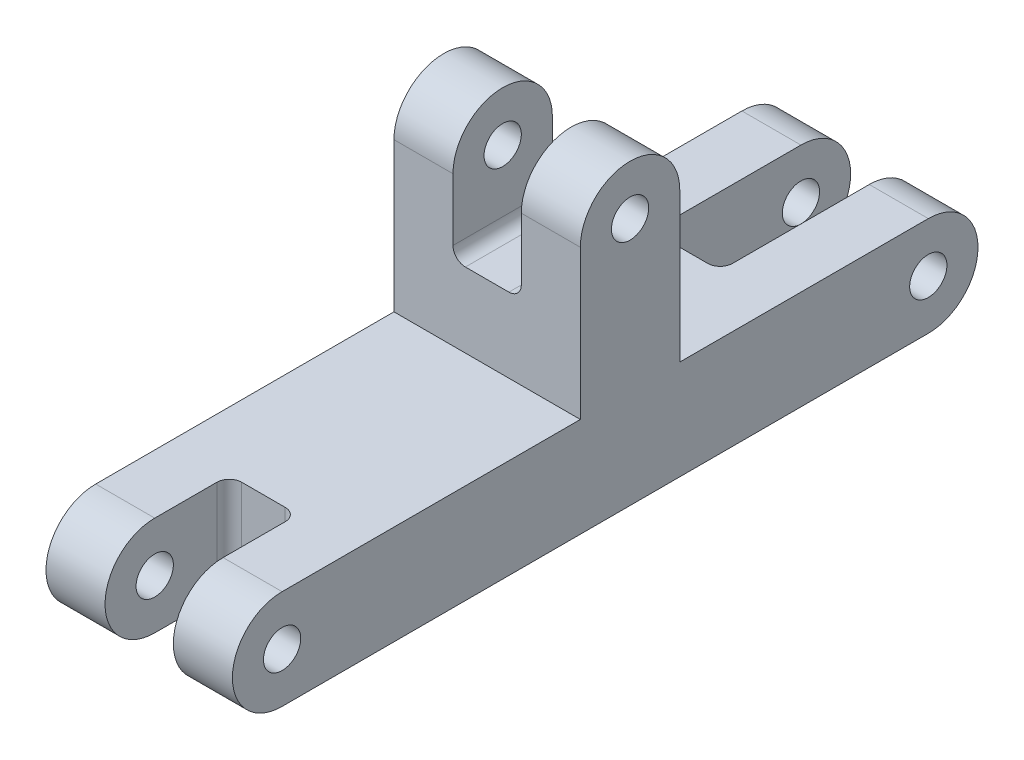
from build123d import *

# Parameters (mm, degrees)
CROQUIS1_R              = 1.5
SALIENTE_EXTRUIR1_DEPTH = 7.5
CROQUIS2_W              = 8
CROQUIS2_H              = 10
CROQUIS2_W_2            = 16
CROQUIS2_H_2            = 8
CROQUIS2_W_3            = 10
CORTAR_EXTRUIR1_DEPTH   = 2.75
REDONDEO1_R             = 1


with BuildPart() as part:
    # Croquis1 → Saliente-Extruir1 (new, symmetric)
    with BuildSketch(Plane(origin=(0, 0, 0), x_dir=(0, 0, -1), z_dir=(1, 0, 0))):
        with BuildLine():
            Line((-10, -4), (10, -4))
            ThreePointArc((10, -4), (14, 0), (10, 4))
            Line((10, 4), (-10, 4))
            Line((-10, 4), (-10, 16))
            ThreePointArc((-10, 16), (-14, 20), (-18, 16))
            Line((-18, 16), (-18, 4))
            Line((-18, 4), (-42, 4))
            ThreePointArc((-42, 4), (-46, 0), (-42, -4))
            Line((-42, -4), (-10, -4))
        make_face()
        with Locations((10, 0)):
            Circle(CROQUIS1_R, mode=Mode.SUBTRACT)
        with Locations((-14, 16)):
            Circle(CROQUIS1_R, mode=Mode.SUBTRACT)
        with Locations((-42, 0)):
            Circle(CROQUIS1_R, mode=Mode.SUBTRACT)
    extrude(amount=SALIENTE_EXTRUIR1_DEPTH, both=True)

    # Croquis2 → Cortar-Extruir1 (cut, symmetric)
    with BuildSketch(Plane(origin=(0, 0, 0), x_dir=(0, 0, -1), z_dir=(1, 0, 0))):
        with Locations((-14, 15)):
            Rectangle(CROQUIS2_W, CROQUIS2_H)
        with Locations((6, 0)):
            Rectangle(CROQUIS2_W_2, CROQUIS2_H_2)
        with Locations((-41, 0)):
            Rectangle(CROQUIS2_W_3, CROQUIS2_H_2)
    extrude(amount=CORTAR_EXTRUIR1_DEPTH, both=True, mode=Mode.SUBTRACT)

    # Redondeo1
    redondeo1_edges = [part.edges().sort_by_distance(p)[0] for p in [
        (2.75, 0, 36),
        (-2.75, 0, 36),
        (2.75, 0, 2),
        (-2.75, 0, 2),
        (2.75, 10, 14),
        (-2.75, 10, 14),
    ]]
    fillet(redondeo1_edges, radius=REDONDEO1_R)


solid = part.part
